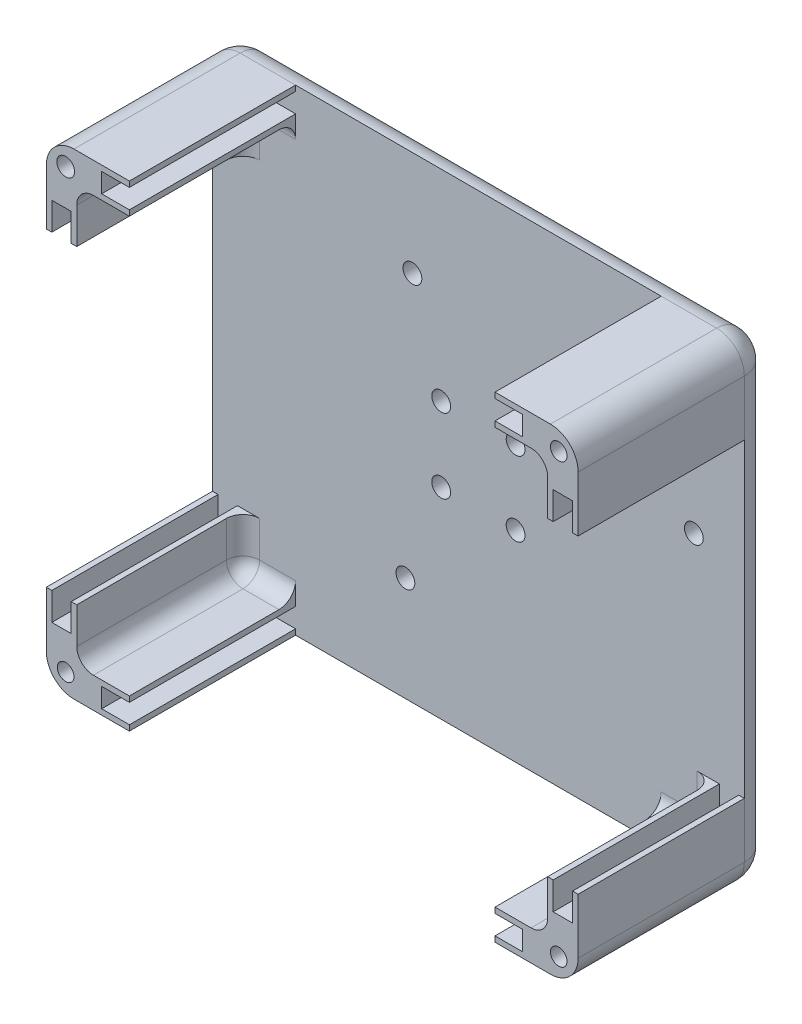
from build123d import *

# Parameters (mm, degrees)
ESQUISSE1_W             = 96
ESQUISSE1_H             = 86
BOSS_EXTRU_1_DEPTH      = 5
BOSS_EXTRU_4_DEPTH      = 30
CONG_2_R                = 5
ESQUISSE4_R             = 1.6
ENL_V_MAT_EXTRU_1_DEPTH = 10
BOSS_EXTRU_17_DEPTH     = 30
ESQUISSE22_R            = 1.5
ENL_V_MAT_EXTRU_5_DEPTH = 10
BOSS_EXTRU_14_DEPTH     = 20
BOSS_EXTRU_15_DEPTH     = 30
ESQUISSE17_R            = 1.5
ENL_V_MAT_EXTRU_3_DEPTH = 10
BOSS_EXTRU_16_DEPTH     = 30
ESQUISSE19_R            = 1.5
ENL_V_MAT_EXTRU_4_DEPTH = 10
CONG_6_R                = 5
CONG_14_R               = 3
TROUM3_D                = 3.4


# Some blends are built 0.0001 mm under size
with BuildPart() as part:
    # Esquisse1 → Boss.-Extru.1 (new body)
    with BuildSketch(Plane.XY):
        with Locations((2.2, -13.159463773)):
            Rectangle(ESQUISSE1_W, ESQUISSE1_H)
    extrude(amount=BOSS_EXTRU_1_DEPTH)

    # Esquisse2 → Boss.-Extru.4 (add)
    with BuildSketch(Plane.XY.offset(5)):
        Polygon((-45.8, 29.840536227), (-45.8, 14.840536227), (-44.8, 14.840536227), (-44.8, 19.840536227), (-41.3, 19.840536227), (-41.3, 14.840536227), (-40.3, 14.840536227), (-40.3, 24.340536227), (-30.8, 24.340536227), (-30.8, 25.340536227), (-35.8, 25.340536227), (-35.8, 28.840536227), (-30.8, 28.840536227), (-30.8, 29.840536227), align=None)
    extrude(amount=BOSS_EXTRU_4_DEPTH)

    # Congé2
    cong_2_edges = [part.edges().sort_by_distance(p)[0] for p in [
        (-45.8, -13.159463773, 0),
        (2.2, -56.159463773, 0),
        (50.2, -13.159463773, 0),
        (2.2, 29.840536227, 0),
    ]]
    fillet(cong_2_edges, radius=CONG_2_R - 0.0001)  # a hair under: the kernel refuses the full size

    # Esquisse4 → Enlèv. mat.-Extru.1 (cut)
    with BuildSketch(Plane.XY.offset(35)):
        with Locations((-42.3, 26.340536227)):
            Circle(ESQUISSE4_R)
    extrude(amount=-ENL_V_MAT_EXTRU_1_DEPTH, mode=Mode.SUBTRACT)

    # Esquisse21 → Boss.-Extru.17 (add)
    with BuildSketch(Plane.XY.offset(5)):
        Polygon((-45.8, -56.159463773), (-45.8, -41.159463773), (-44.8, -41.159463773), (-44.8, -46.159463773), (-41.3, -46.159463773), (-41.3, -41.159463773), (-40.3, -41.159463773), (-40.3, -50.659463773), (-30.8, -50.659463773), (-30.8, -51.659463773), (-35.8, -51.659463773), (-35.8, -55.159463773), (-30.8, -55.159463773), (-30.8, -56.159463773), align=None)
    extrude(amount=BOSS_EXTRU_17_DEPTH)

    # Esquisse22 → Enlèv. mat.-Extru.5 (cut)
    with BuildSketch(Plane.XY.offset(35)):
        with Locations((-42.3, -52.659463773)):
            Circle(ESQUISSE22_R)
    extrude(amount=-ENL_V_MAT_EXTRU_5_DEPTH, mode=Mode.SUBTRACT)

    # Esquisse14 → Boss.-Extru.14 (add)
    with BuildSketch(Plane.XY.offset(5)):
        Polygon((-45.8, -56.159463773), (-45.8, -41.159463773), (-44.8, -41.159463773), (-44.8, -46.159463773), (-41.3, -46.159463773), (-41.3, -41.159463773), (-40.3, -41.159463773), (-40.3, -50.659463773), (-30.8, -50.659463773), (-30.8, -51.659463773), (-35.8, -51.659463773), (-35.8, -55.159463773), (-30.8, -55.159463773), (-30.8, -56.159463773), align=None)
    extrude(amount=BOSS_EXTRU_14_DEPTH)

    # Esquisse16 → Boss.-Extru.15 (add)
    with BuildSketch(Plane.XY.offset(5)):
        Polygon((50.2, 29.840536227), (35.2, 29.840536227), (35.2, 28.840536227), (40.2, 28.840536227), (40.2, 25.340536227), (35.2, 25.340536227), (35.2, 24.340536227), (44.7, 24.340536227), (44.7, 14.840536227), (45.7, 14.840536227), (45.7, 19.840536227), (49.2, 19.840536227), (49.2, 14.840536227), (50.2, 14.840536227), align=None)
    extrude(amount=BOSS_EXTRU_15_DEPTH)

    # Esquisse17 → Enlèv. mat.-Extru.3 (cut)
    with BuildSketch(Plane.XY.offset(35)):
        with Locations((46.7, 26.340536227)):
            Circle(ESQUISSE17_R)
    extrude(amount=-ENL_V_MAT_EXTRU_3_DEPTH, mode=Mode.SUBTRACT)

    # Esquisse18 → Boss.-Extru.16 (add)
    with BuildSketch(Plane.XY.offset(5)):
        Polygon((50.2, -56.159463773), (50.2, -41.159463773), (49.2, -41.159463773), (49.2, -46.159463773), (45.7, -46.159463773), (45.7, -41.159463773), (44.7, -41.159463773), (44.7, -50.659463773), (35.2, -50.659463773), (35.2, -51.659463773), (40.2, -51.659463773), (40.2, -55.159463773), (35.2, -55.159463773), (35.2, -56.159463773), align=None)
    extrude(amount=BOSS_EXTRU_16_DEPTH)

    # Esquisse19 → Enlèv. mat.-Extru.4 (cut)
    with BuildSketch(Plane.XY.offset(35)):
        with Locations((46.7, -52.659463773)):
            Circle(ESQUISSE19_R)
    extrude(amount=-ENL_V_MAT_EXTRU_4_DEPTH, mode=Mode.SUBTRACT)

    # Congé6
    # the kernel refuses this fillet: 5 mm, written as the material it takes off along each edge
    with BuildSketch(Plane(origin=(-40.8, 24.840536227, 0), x_dir=(-1, 0, 0), z_dir=(0, -1, 0))) as cong_6_piece_1:
        with BuildLine():
            CenterArc((0.0001, -4.9999), 4.9999, 0, 90)
            Line((5, -4.9999), (5, 0))
            Line((5, 0), (0.0001, 0))
        make_face()
    revolve(axis=Axis((-40.8, 24.840536227, 0), (0, 0, -1)), revolution_arc=90, mode=Mode.SUBTRACT)
    with BuildSketch(Plane(origin=(45.2, 24.840536227, 0), x_dir=(0, 1, 0), z_dir=(-1, 0, 0))) as cong_6_piece_2:
        with BuildLine():
            CenterArc((0.0001, -4.9999), 4.9999, 0, 90)
            Line((5, -4.9999), (5, 0))
            Line((5, 0), (0.0001, 0))
        make_face()
    revolve(axis=Axis((45.2, 24.840536227, 0), (0, 0, -1)), revolution_arc=90, mode=Mode.SUBTRACT)
    with BuildSketch(Plane(origin=(-40.8, -51.159463773, 0), x_dir=(0, -1, 0), z_dir=(1, 0, 0))) as cong_6_piece_3:
        with BuildLine():
            CenterArc((0.0001, -4.9999), 4.9999, 0, 90)
            Line((5, -4.9999), (5, 0))
            Line((5, 0), (0.0001, 0))
        make_face()
    revolve(axis=Axis((-40.8, -51.159463773, 0), (0, 0, -1)), revolution_arc=90, mode=Mode.SUBTRACT)
    with BuildSketch(Plane(origin=(45.2, -51.159463773, 0), x_dir=(1, 0, 0), z_dir=(0, 1, 0))) as cong_6_piece_4:
        with BuildLine():
            CenterArc((0.0001, -4.9999), 4.9999, 0, 90)
            Line((5, -4.9999), (5, 0))
            Line((5, 0), (0.0001, 0))
        make_face()
    revolve(axis=Axis((45.2, -51.159463773, 0), (0, 0, -1)), revolution_arc=90, mode=Mode.SUBTRACT)
    with BuildSketch(Plane(origin=(50.2, 29.840536227, 0), x_dir=(0, -1, 0), z_dir=(0, 0, 1)), Plane(origin=(50.2, -56.159463773, 0), x_dir=(-1, 0, 0), z_dir=(0, 0, 1)), Plane(origin=(-45.8, -56.159463773, 47.5), x_dir=(1, 0, 0), z_dir=(0, 0, -1)), Plane(origin=(-45.8, 29.840536227, 47.5), x_dir=(0, -1, 0), z_dir=(0, 0, -1))) as cong_6_piece_5:
        with BuildLine():
            CenterArc((CONG_6_R, -CONG_6_R), CONG_6_R, 90, 90)
            Line((0, -CONG_6_R), (0, 0))
            Line((0, 0), (CONG_6_R, 0))
        make_face()
    extrude(amount=47.5, mode=Mode.SUBTRACT)

    # Congé14
    cong_14_edges = [part.edges().sort_by_distance(p)[0] for p in [
        (39.95, 24.340536227, 5),
        (44.7, 19.590536227, 5),
        (44.7, 24.340536227, 20),
        (-40.3, 19.590536227, 5),
        (44.7, -45.909463773, 5),
        (-35.55, 24.340536227, 5),
        (39.95, -50.659463773, 5),
        (44.7, -50.659463773, 20),
        (-40.3, 24.340536227, 20),
        (-35.55, -50.659463773, 5),
        (-40.3, -45.909463773, 5),
        (-40.3, -50.659463773, 20),
    ]]
    fillet(cong_14_edges, radius=CONG_14_R)

    # TrouM3 (through all)
    with Locations(Plane.XY.offset(5)):
        with Locations((-9.71, 10.960536227), (41.09, -4.279463773), (-10.98, -37.299463773), (-4.517514421, -19.876978194), (-4.517514421, -6.441949352), (8.917514421, -6.441949352), (8.917514421, -19.876978194)):
            Hole(TROUM3_D / 2)


solid = part.part
